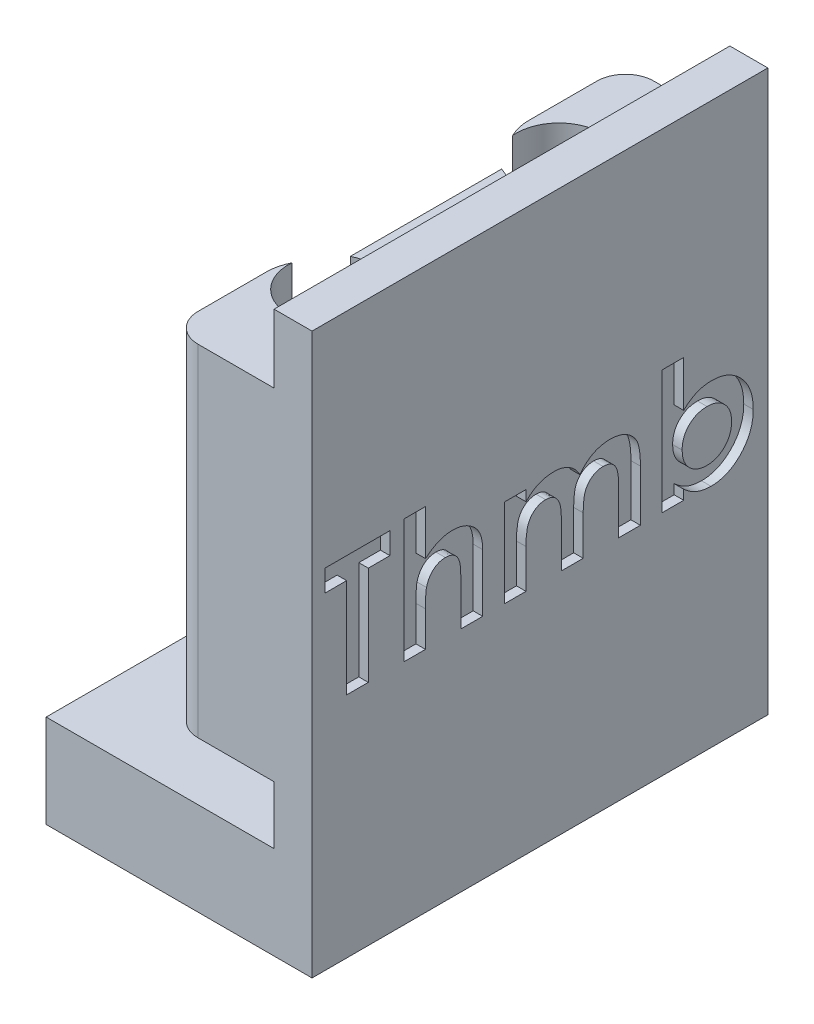
from build123d import *

# Parameters (mm, degrees)
SKETCH1_W           = 12
SKETCH1_H           = 24
BOSS_EXTRUDE1_DEPTH = 4.9
SKETCH2_W           = 2
SKETCH2_H           = 24
BOSS_EXTRUDE2_DEPTH = 29.5
BOSS_EXTRUDE4_START = 3.05
SKETCH4_W           = 5.5
SKETCH4_H           = 24
BOSS_EXTRUDE4_DEPTH = 17.95
SKETCH5_W           = 9.25
SKETCH5_H           = 17.95
CUT_EXTRUDE1_DEPTH  = 1.5
FILLET1_R           = 2.5
SKETCH6_R           = 2.25
CUT_EXTRUDE2_DEPTH  = 30.644729717
FILLET2_R           = 1.5
CUT_EXTRUDE3_DEPTH  = 0.5


with BuildPart() as part:
    # Sketch1 → Boss-Extrude1 (new body)
    with BuildSketch(Plane(origin=(0, 0, 0), x_dir=(1, 0, 0), z_dir=(0, 1, 0))):
        Rectangle(SKETCH1_W, SKETCH1_H)
    extrude(amount=BOSS_EXTRUDE1_DEPTH)

    # Sketch2 → Boss-Extrude2 (add)
    with BuildSketch(Plane(origin=(0, 0, 0), x_dir=(1, 0, 0), z_dir=(0, 1, 0))):
        with Locations((7, 0)):
            Rectangle(SKETCH2_W, SKETCH2_H)
    extrude(amount=BOSS_EXTRUDE2_DEPTH)

    # Sketch4 → Boss-Extrude4 (add)
    with BuildSketch(Plane(origin=(0, 4.9, 0), x_dir=(1, 0, 0), z_dir=(0, 1, 0)).offset(BOSS_EXTRUDE4_START)):
        with Locations((3.25, 0)):
            Rectangle(SKETCH4_W, SKETCH4_H)
    extrude(amount=BOSS_EXTRUDE4_DEPTH)

    # Sketch5 → Cut-Extrude1 (cut)
    with BuildSketch(Plane.ZY.offset(-0.5)):
        with Locations((0, 16.925)):
            Rectangle(SKETCH5_W, SKETCH5_H)
    extrude(amount=-CUT_EXTRUDE1_DEPTH, mode=Mode.SUBTRACT)

    # Fillet1
    # the kernel refuses this fillet: 2.5 mm, written as the material it takes off along each edge
    with BuildSketch(Plane(origin=(0.5, 31.628219619, 4.625), x_dir=(0, 0, 1), z_dir=(0, -1, 0)), Plane(origin=(0.5, 7.95, -4.625), x_dir=(0, 0, -1), z_dir=(0, 1, 0))) as fillet1_piece_1:
        with BuildLine():
            CenterArc((2.291287847, -2.5), FILLET1_R, 90, 66.421821522)
            Line((0, -1.5), (0, 0))
            Line((0, 0), (2.291287847, 0))
        make_face()
    extrude(amount=23.678219619, mode=Mode.SUBTRACT)

    # Sketch6 → Cut-Extrude2 (cut, through all)
    with BuildSketch(Plane(origin=(0, 25.9, 0), x_dir=(1, 0, 0), z_dir=(0, 1, 0))):
        with Locations(Location((3, -6, 0), (0, 0, 270))):
            Circle(SKETCH6_R)
        with Locations(Location((3, 6, 0), (0, 0, 270))):
            Circle(SKETCH6_R)
    extrude(amount=-CUT_EXTRUDE2_DEPTH, mode=Mode.SUBTRACT)

    # Fillet2
    fillet2_edges = [part.edges().sort_by_distance(p)[0] for p in [
        (0.5, 16.925, -12),
        (0.5, 16.925, 12),
    ]]
    fillet(fillet2_edges, radius=FILLET2_R)

    # Sketch7 → Cut-Extrude3 (cut)
    # profile 1 of 4: a face of its own
    with BuildSketch(Plane(origin=(8, 0, 0), x_dir=(0, 0, -1), z_dir=(1, 0, 0))):
        Polygon((-11.318589744, 18.35), (-7.899358974, 18.35), (-7.899358974, 17.21025641), (-9.039102564, 17.21025641), (-9.039102564, 12), (-10.178846154, 12), (-10.178846154, 17.21025641), (-11.318589744, 17.21025641), align=None)
    # profile 2 of 4: a face of its own
    with BuildSketch(Plane(origin=(8, 0, 0), x_dir=(0, 0, -1), z_dir=(1, 0, 0))):
        with BuildLine():
            Line((-7.166666667, 18.512820513), (-6.026923077, 18.512820513))
            Line((-6.026923077, 18.512820513), (-6.026923077, 16.137930689))
            add(Edge.make_bspline(
                [(-6.026923077, 16.137930689), (-5.969511777, 16.18462095), (-5.857607204, 16.275628358), (-5.682025261, 16.394189417), (-5.506806487, 16.495362785), (-5.330091554, 16.577356882), (-5.152647115, 16.641610855), (-4.974166752, 16.6871787), (-4.794478645, 16.717075228), (-4.674018423, 16.720219979), (-4.613691907, 16.721794872)],
                knots=[0, 0, 0, 0, 1.13710654, 2.216417683, 3.252896077, 4.244436563, 5.207303112, 6.149540546, 7.073289332, 8, 8, 8, 8], degree=3))
            add(Edge.make_bspline(
                [(-4.613691907, 16.721794872), (-4.55596348, 16.720263096), (-4.44263773, 16.71725609), (-4.276381984, 16.695536064), (-4.117142181, 16.6581615), (-3.96452604, 16.606783681), (-3.819583533, 16.537688084), (-3.680429843, 16.456751316), (-3.548718997, 16.359781497), (-3.468580449, 16.285032431), (-3.428155048, 16.247325721)],
                knots=[0, 0, 0, 0, 1.056403236, 2.073808271, 3.062028718, 4.046096703, 5.014652014, 5.995532726, 6.988858718, 8, 8, 8, 8], degree=3))
            add(Edge.make_bspline(
                [(-3.428155048, 16.247325721), (-3.394955122, 16.212092254), (-3.328073573, 16.141114117), (-3.244774388, 16.018749449), (-3.172846374, 15.88546396), (-3.114235296, 15.740005178), (-3.070645337, 15.582305393), (-3.036897869, 15.413663758), (-3.018234802, 15.232238899), (-3.015931521, 15.107198632), (-3.01474359, 15.042708333)],
                knots=[0, 0, 0, 0, 0.887296576, 1.787466942, 2.706642908, 3.663267187, 4.658426068, 5.705361056, 6.816525637, 8, 8, 8, 8], degree=3))
            Line((-3.01474359, 15.042708333), (-3.01474359, 12))
            Line((-3.01474359, 12), (-4.154487179, 12))
            Line((-4.154487179, 12), (-4.154487179, 14.017447917))
            add(Edge.make_bspline(
                [(-4.154487179, 14.017447917), (-4.154708634, 14.081475623), (-4.155132521, 14.204031258), (-4.158939035, 14.380024368), (-4.165155191, 14.53990738), (-4.173656068, 14.683728611), (-4.185525149, 14.810887009), (-4.197199225, 14.922293997), (-4.213580689, 15.01741556), (-4.238109855, 15.120774178), (-4.278028904, 15.231324562), (-4.336037779, 15.349166519), (-4.413521697, 15.446422352), (-4.503190171, 15.526634032), (-4.606867886, 15.58785462), (-4.720843282, 15.633071084), (-4.847064832, 15.658499705), (-4.934555931, 15.661764394), (-4.980038061, 15.663461538)],
                knots=[0, 0, 0, 0, 1.461461505, 2.797388094, 4.017818807, 5.113567707, 6.085313608, 6.932873269, 7.669572396, 8.286941306, 9.355291607, 10.346554054, 11.270113241, 12.175128673, 13.078071705, 14.003657132, 14.962203834, 16, 16, 16, 16], degree=3))
            add(Edge.make_bspline(
                [(-4.980038061, 15.663461538), (-5.039287802, 15.661145271), (-5.1553351, 15.6566086), (-5.321752058, 15.609908997), (-5.475249809, 15.536094346), (-5.61403689, 15.433790561), (-5.734975103, 15.305650997), (-5.836302662, 15.155458631), (-5.919183058, 14.984715712), (-5.955005457, 14.860207023), (-5.973497596, 14.795933494)],
                knots=[0, 0, 0, 0, 0.993549393, 1.945978497, 2.879753144, 3.843180486, 4.826017097, 5.826060929, 6.877775219, 8, 8, 8, 8], degree=3))
            add(Edge.make_bspline(
                [(-5.973497596, 14.795933494), (-5.978102178, 14.776067481), (-5.988602132, 14.730766471), (-5.996643196, 14.653475167), (-6.008576006, 14.560043225), (-6.012715306, 14.449910751), (-6.020469197, 14.323247612), (-6.023257801, 14.179848875), (-6.026065217, 14.019579727), (-6.026627931, 13.907207064), (-6.026923077, 13.848267228)],
                knots=[0, 0, 0, 0, 0.514379255, 1.17295301, 1.959069106, 2.891908278, 3.953016936, 5.163065833, 6.51201855, 8, 8, 8, 8], degree=3))
            Line((-6.026923077, 13.848267228), (-6.026923077, 12))
            Line((-6.026923077, 12), (-7.166666667, 12))
            Line((-7.166666667, 12), (-7.166666667, 18.512820513))
        make_face()
    # profile 3 of 4: a face of its own
    with BuildSketch(Plane(origin=(8, 0, 0), x_dir=(0, 0, -1), z_dir=(1, 0, 0))):
        with BuildLine():
            Line((-1.875, 16.640384615), (-0.73525641, 16.640384615))
            Line((-0.73525641, 16.640384615), (-0.73525641, 16.085777244))
            add(Edge.make_bspline(
                [(-0.73525641, 16.085777244), (-0.684561194, 16.136943285), (-0.584746481, 16.237685014), (-0.419333976, 16.367197564), (-0.246791983, 16.477946795), (-0.065029568, 16.567605268), (0.125508686, 16.636065987), (0.323919727, 16.686232992), (0.531222677, 16.715829954), (0.672367968, 16.719784526), (0.744120593, 16.721794872)],
                knots=[0, 0, 0, 0, 1.041528618, 2.050684245, 3.032913108, 4.004406485, 4.976926473, 5.95771665, 6.961784757, 8, 8, 8, 8], degree=3))
            add(Edge.make_bspline(
                [(0.744120593, 16.721794872), (0.815967957, 16.719534952), (0.957397169, 16.715086374), (1.163741406, 16.674377711), (1.359219602, 16.60823989), (1.541681038, 16.513968553), (1.712444438, 16.397548351), (1.863944871, 16.252964651), (2.000313468, 16.085973016), (2.073003179, 15.959725545), (2.110286458, 15.894971955)],
                knots=[0, 0, 0, 0, 1.023965777, 2.015643508, 2.987309376, 3.958410333, 4.93654923, 5.924956801, 6.93568961, 8, 8, 8, 8], degree=3))
            add(Edge.make_bspline(
                [(2.110286458, 15.894971955), (2.15831214, 15.959901699), (2.252573076, 16.087340566), (2.41965917, 16.253726455), (2.600329088, 16.397563428), (2.798078377, 16.514828049), (3.007655502, 16.607918111), (3.228143378, 16.674131973), (3.45754299, 16.715018338), (3.613662015, 16.719517262), (3.692698317, 16.721794872)],
                knots=[0, 0, 0, 0, 1.041189987, 2.043563759, 3.033412161, 4.015238574, 5.00275396, 5.986226558, 6.980513695, 8, 8, 8, 8], degree=3))
            add(Edge.make_bspline(
                [(3.692698317, 16.721794872), (3.774333432, 16.719429925), (3.93331023, 16.714824411), (4.163690439, 16.669514213), (4.379469383, 16.599503159), (4.575878408, 16.49761994), (4.753477691, 16.376935233), (4.904813705, 16.234341215), (5.030408768, 16.074813601), (5.11218726, 15.925853734), (5.165054859, 15.794156154), (5.196976784, 15.679554583), (5.226833661, 15.551587434), (5.248282839, 15.40853465), (5.2683047, 15.251740814), (5.279928178, 15.08016351), (5.287828777, 14.894380741), (5.28866792, 14.765838655), (5.289102564, 14.699258814)],
                knots=[0, 0, 0, 0, 1.321991808, 2.574456155, 3.791773975, 4.987670122, 6.148905103, 7.262530793, 8.344737981, 9.427709016, 10.004683293, 10.642050061, 11.354108788, 12.133887687, 12.985666279, 13.916212488, 14.92067847, 16, 16, 16, 16], degree=3))
            Line((5.289102564, 14.699258814), (5.289102564, 12))
            Line((5.289102564, 12), (4.149358974, 12))
            Line((4.149358974, 12), (4.149358974, 14.33036859))
            add(Edge.make_bspline(
                [(4.149358974, 14.33036859), (4.148410354, 14.392701618), (4.146589562, 14.512344233), (4.138848675, 14.683948721), (4.121521259, 14.839579184), (4.101211307, 14.980097667), (4.072147375, 15.104759127), (4.036709186, 15.213864074), (3.995601103, 15.307569563), (3.945964331, 15.385865825), (3.890371088, 15.451803646), (3.828531626, 15.508325416), (3.761090714, 15.556549671), (3.687436902, 15.597653995), (3.605640649, 15.625453663), (3.518463268, 15.647266275), (3.425222568, 15.662120819), (3.36075597, 15.663006404), (3.327624199, 15.663461538)],
                knots=[0, 0, 0, 0, 1.669139205, 3.203761885, 4.596586177, 5.860166715, 7.002923539, 8.018877315, 8.928339525, 9.734594377, 10.491888885, 11.231098709, 11.971440889, 12.708030942, 13.480072485, 14.275788656, 15.113863979, 16, 16, 16, 16], degree=3))
            add(Edge.make_bspline(
                [(3.327624199, 15.663461538), (3.276568609, 15.661696414), (3.176382174, 15.65823271), (3.030390119, 15.625133132), (2.893010519, 15.571018866), (2.764758055, 15.4974012), (2.648392436, 15.405454125), (2.546601976, 15.296396128), (2.462537251, 15.169598697), (2.404345599, 15.051956115), (2.367983127, 14.945583582), (2.342332707, 14.854484051), (2.322339225, 14.751463955), (2.306690182, 14.637566651), (2.291676753, 14.512148266), (2.284311248, 14.375367395), (2.27677409, 14.227414061), (2.276872208, 14.125159273), (2.276923077, 14.072145433)],
                knots=[0, 0, 0, 0, 1.129913425, 2.217230253, 3.297175357, 4.391411011, 5.481605898, 6.571841268, 7.681894157, 8.841607612, 9.468549532, 10.170608623, 10.93710061, 11.791434153, 12.717934886, 13.734733707, 14.825576123, 16, 16, 16, 16], degree=3))
            Line((2.276923077, 14.072145433), (2.276923077, 12))
            Line((2.276923077, 12), (1.137179487, 12))
            Line((1.137179487, 12), (1.137179487, 14.224789663))
            add(Edge.make_bspline(
                [(1.137179487, 14.224789663), (1.137083794, 14.274405402), (1.136899711, 14.369850012), (1.131366552, 14.507673855), (1.124039569, 14.634935274), (1.113767991, 14.751989223), (1.101921749, 14.858690115), (1.084824891, 14.954454223), (1.066863065, 15.039809236), (1.036067271, 15.136769983), (0.992672038, 15.244218718), (0.927838924, 15.358162119), (0.849446835, 15.453562864), (0.759477126, 15.531163374), (0.657807494, 15.590288736), (0.547013548, 15.634270657), (0.424979746, 15.658010748), (0.340979836, 15.661606266), (0.297636218, 15.663461538)],
                knots=[0, 0, 0, 0, 1.256487322, 2.417074606, 3.49288742, 4.484586665, 5.393016842, 6.210437544, 6.947749329, 7.599905853, 8.784490193, 9.876739139, 10.906602197, 11.896672079, 12.869113195, 13.872201355, 14.902064413, 16, 16, 16, 16], degree=3))
            add(Edge.make_bspline(
                [(0.297636218, 15.663461538), (0.24866166, 15.661799257), (0.151667137, 15.658507095), (0.010379798, 15.623146581), (-0.124704002, 15.57002521), (-0.250612555, 15.494354236), (-0.365225119, 15.400243367), (-0.46599644, 15.288083306), (-0.549619372, 15.158007095), (-0.608069326, 15.03711951), (-0.64390159, 14.92809313), (-0.670241712, 14.834628112), (-0.68949131, 14.729339283), (-0.705552126, 14.613408847), (-0.720476671, 14.486699961), (-0.727872651, 14.348655411), (-0.735402362, 14.199428206), (-0.735306234, 14.096326232), (-0.73525641, 14.042888622)],
                knots=[0, 0, 0, 0, 1.07893236, 2.136834559, 3.195274846, 4.273923004, 5.364443877, 6.458052972, 7.587287137, 8.767908, 9.410170275, 10.118584836, 10.909717261, 11.770069756, 12.702352573, 13.724628867, 14.820678298, 16, 16, 16, 16], degree=3))
            Line((-0.73525641, 14.042888622), (-0.73525641, 12))
            Line((-0.73525641, 12), (-1.875, 12))
            Line((-1.875, 12), (-1.875, 16.640384615))
        make_face()
    # profile 4 of 4: a face of its own
    with BuildSketch(Plane(origin=(8, 0, 0), x_dir=(0, 0, -1), z_dir=(1, 0, 0))):
        with BuildLine():
            Line((7.568589744, 18.512820513), (7.568589744, 16.099769631))
            add(Edge.make_bspline(
                [(7.568589744, 16.099769631), (7.621514223, 16.149601219), (7.725407795, 16.247423279), (7.895036837, 16.373917908), (8.07075232, 16.480678339), (8.252396831, 16.570245346), (8.441605184, 16.636476286), (8.636052615, 16.687940208), (8.837731569, 16.715196585), (8.974118523, 16.719583294), (9.042878606, 16.721794872)],
                knots=[0, 0, 0, 0, 1.061187343, 2.083167259, 3.083809127, 4.061667593, 5.035358583, 6.007314429, 6.995378812, 8, 8, 8, 8], degree=3))
            add(Edge.make_bspline(
                [(9.042878606, 16.721794872), (9.117621747, 16.720004585), (9.264841484, 16.716478301), (9.481447314, 16.683555376), (9.689024892, 16.630337732), (9.888365763, 16.556031398), (10.078407864, 16.459557032), (10.261286452, 16.344047195), (10.43384757, 16.204735316), (10.596175107, 16.046941255), (10.746332122, 15.873987242), (10.876941072, 15.685949523), (10.985733259, 15.485303034), (11.077939983, 15.274419837), (11.145236153, 15.049802504), (11.197102426, 14.814464126), (11.226005224, 14.566413689), (11.230009806, 14.397432255), (11.232051282, 14.311288061)],
                knots=[0, 0, 0, 0, 0.985987466, 1.942075377, 2.884088208, 3.810275091, 4.743821533, 5.692411115, 6.659945104, 7.665215984, 8.677116751, 9.678438675, 10.680260931, 11.685531812, 12.710472044, 13.769734641, 14.863044265, 16, 16, 16, 16], degree=3))
            add(Edge.make_bspline(
                [(11.232051282, 14.311288061), (11.230119161, 14.228092812), (11.226310525, 14.064096634), (11.195539148, 13.82333675), (11.14338424, 13.593342809), (11.070221475, 13.374031982), (10.977211888, 13.164711208), (10.863687268, 12.965524721), (10.728985401, 12.777168275), (10.574986406, 12.602179221), (10.406720125, 12.443713623), (10.231398721, 12.301538477), (10.045530369, 12.185037094), (9.853761362, 12.08664275), (9.65307061, 12.0114025), (9.444828921, 11.958688248), (9.229366097, 11.9234455), (9.082877621, 11.92022445), (9.008533654, 11.918589744)],
                knots=[0, 0, 0, 0, 1.098553145, 2.165490463, 3.199345634, 4.208780719, 5.21409072, 6.219899742, 7.23156933, 8.267303578, 9.293302409, 10.281606823, 11.243293419, 12.184993323, 13.124258899, 14.066907486, 15.018941492, 16, 16, 16, 16], degree=3))
            add(Edge.make_bspline(
                [(9.008533654, 11.918589744), (8.942309898, 11.920360079), (8.811910507, 11.923846), (8.619696379, 11.949700264), (8.43498558, 11.993182156), (8.255444774, 12.053078742), (8.080586809, 12.13491509), (7.90736653, 12.237240737), (7.734669127, 12.361350338), (7.625063914, 12.456991071), (7.568589744, 12.506270032)],
                knots=[0, 0, 0, 0, 0.996418773, 1.962021009, 2.912343664, 3.848616743, 4.805003894, 5.811808768, 6.872532775, 8, 8, 8, 8], degree=3))
            Line((7.568589744, 12.506270032), (7.568589744, 12))
            Line((7.568589744, 12), (6.428846154, 12))
            Line((6.428846154, 12), (6.428846154, 18.512820513))
            Line((6.428846154, 18.512820513), (7.568589744, 18.512820513))
        make_face()
        with BuildLine():
            add(Edge.make_bspline(
                [(8.796103766, 15.663461538), (8.749849571, 15.66203919), (8.659166204, 15.659250614), (8.526026505, 15.643269298), (8.399874295, 15.613200335), (8.278791534, 15.57422788), (8.164311477, 15.521621188), (8.055497547, 15.457851062), (7.953281746, 15.381810055), (7.857133577, 15.296509296), (7.770736802, 15.200545783), (7.693980763, 15.098003791), (7.630301404, 14.987548032), (7.577217718, 14.870579071), (7.537168396, 14.745831315), (7.507463402, 14.614365997), (7.491320621, 14.475780233), (7.488581697, 14.381288387), (7.487179487, 14.33291266)],
                knots=[0, 0, 0, 0, 1.060469436, 2.079096586, 3.066888298, 4.028858836, 4.99004353, 5.948472697, 6.914558426, 7.905691313, 8.889602648, 9.869280844, 10.836099585, 11.806137001, 12.808075328, 13.83377171, 14.890985086, 16, 16, 16, 16], degree=3))
            add(Edge.make_bspline(
                [(7.487179487, 14.33291266), (7.488599341, 14.283690319), (7.491385866, 14.187089355), (7.507394076, 14.045548436), (7.536890571, 13.91144926), (7.577783408, 13.784487791), (7.629963804, 13.664647556), (7.693567715, 13.551484289), (7.771168639, 13.447479038), (7.856616313, 13.348985381), (7.95335899, 13.26254328), (8.055114307, 13.185016607), (8.164285041, 13.121151424), (8.279312202, 13.069405531), (8.399322975, 13.026404976), (8.526105748, 12.997349546), (8.659145177, 12.981071849), (8.749842468, 12.978324432), (8.796103766, 12.976923077)],
                knots=[0, 0, 0, 0, 1.117193555, 2.192540452, 3.22680955, 4.227918444, 5.21468246, 6.188555072, 7.166222992, 8.154674427, 9.142376254, 10.104580718, 11.053462639, 12.005072638, 12.963662044, 13.941614018, 14.950094269, 16, 16, 16, 16], degree=3))
            add(Edge.make_bspline(
                [(8.796103766, 12.976923077), (8.840682323, 12.978224893), (8.928922295, 12.980801741), (9.058032323, 12.998782086), (9.182139225, 13.028163756), (9.300271081, 13.070043264), (9.413147006, 13.124570341), (9.52179459, 13.188376046), (9.622462909, 13.268096511), (9.71910135, 13.355716108), (9.805566936, 13.454525814), (9.883136959, 13.559498112), (9.948298083, 13.671569902), (10.00003448, 13.791112829), (10.042806434, 13.915862579), (10.072008197, 14.048102501), (10.088074472, 14.186652262), (10.0908826, 14.281143399), (10.092307692, 14.329096554)],
                knots=[0, 0, 0, 0, 1.021711385, 2.02240246, 2.981887075, 3.941027022, 4.888772411, 5.852236371, 6.822344989, 7.82661704, 8.838806642, 9.826383926, 10.814965113, 11.80282933, 12.807900643, 13.833672313, 14.900613836, 16, 16, 16, 16], degree=3))
            add(Edge.make_bspline(
                [(10.092307692, 14.329096554), (10.090859842, 14.376618293), (10.088007171, 14.470249424), (10.072269899, 14.607645435), (10.041943825, 14.737962817), (10.003653295, 14.862266167), (9.950157993, 14.978937379), (9.886905192, 15.089356655), (9.812476552, 15.193857398), (9.726136124, 15.2896186), (9.631435891, 15.376754413), (9.530345006, 15.45382676), (9.423260461, 15.519437286), (9.308724, 15.571178617), (9.189438501, 15.613750582), (9.063581035, 15.643074714), (8.931791448, 15.659304329), (8.841940462, 15.66205719), (8.796103766, 15.663461538)],
                knots=[0, 0, 0, 0, 1.094680664, 2.156827393, 3.177782763, 4.17210342, 5.146667393, 6.126451192, 7.099203661, 8.094961544, 9.09004898, 10.058676268, 11.018205477, 11.974998356, 12.947750825, 13.930643515, 14.944335875, 16, 16, 16, 16], degree=3))
        make_face(mode=Mode.SUBTRACT)
    extrude(amount=-CUT_EXTRUDE3_DEPTH, mode=Mode.SUBTRACT)


solid = part.part
